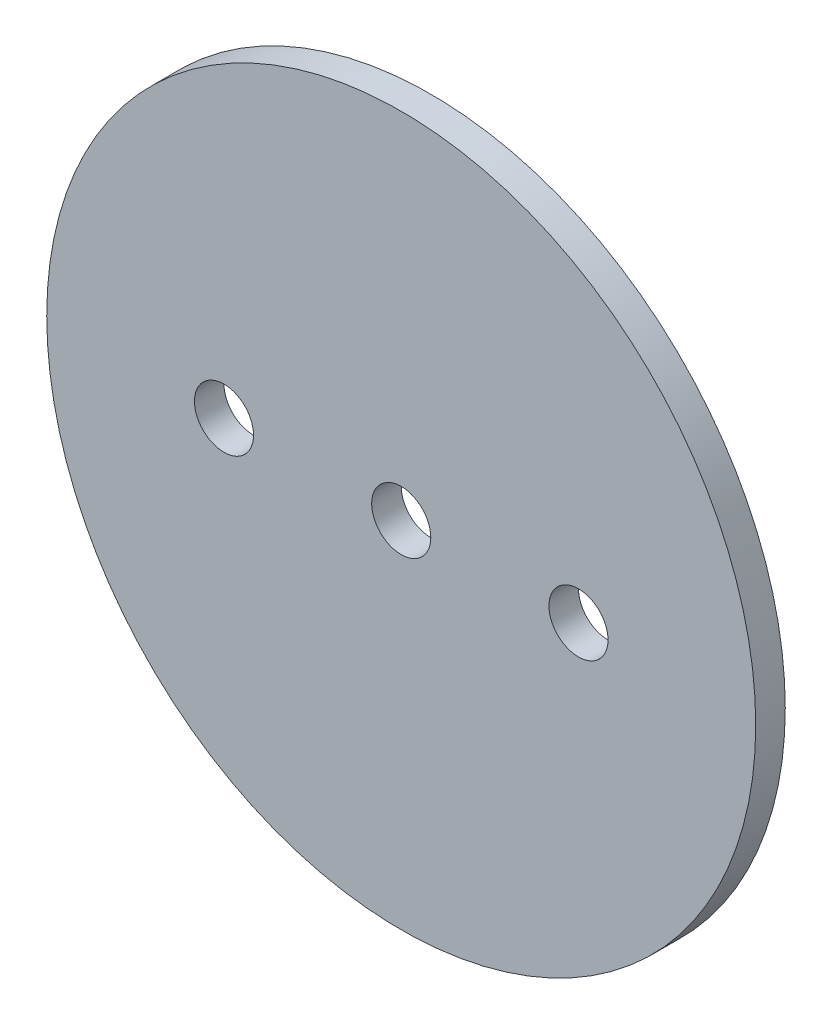
from build123d import *

# Parameters (mm, degrees)
SKETCH1_R                   = 38.1
BOSS_EXTRUDE1_DEPTH         = 1.5875
F_1_4_0_25_DIAMETER_HOLE1_D = 6.35


with BuildPart() as part:
    # Sketch1 → Boss-Extrude1 (new, symmetric)
    with BuildSketch(Plane.XY):
        Circle(SKETCH1_R)
    extrude(amount=BOSS_EXTRUDE1_DEPTH, both=True)

    # 1/4 (0.25) Diameter Hole1 (through all)
    with Locations(Plane.XY.offset(1.5875)):
        with Locations((-19.05, 0), (0, 0), (19.05, 0)):
            Hole(F_1_4_0_25_DIAMETER_HOLE1_D / 2)


solid = part.part
